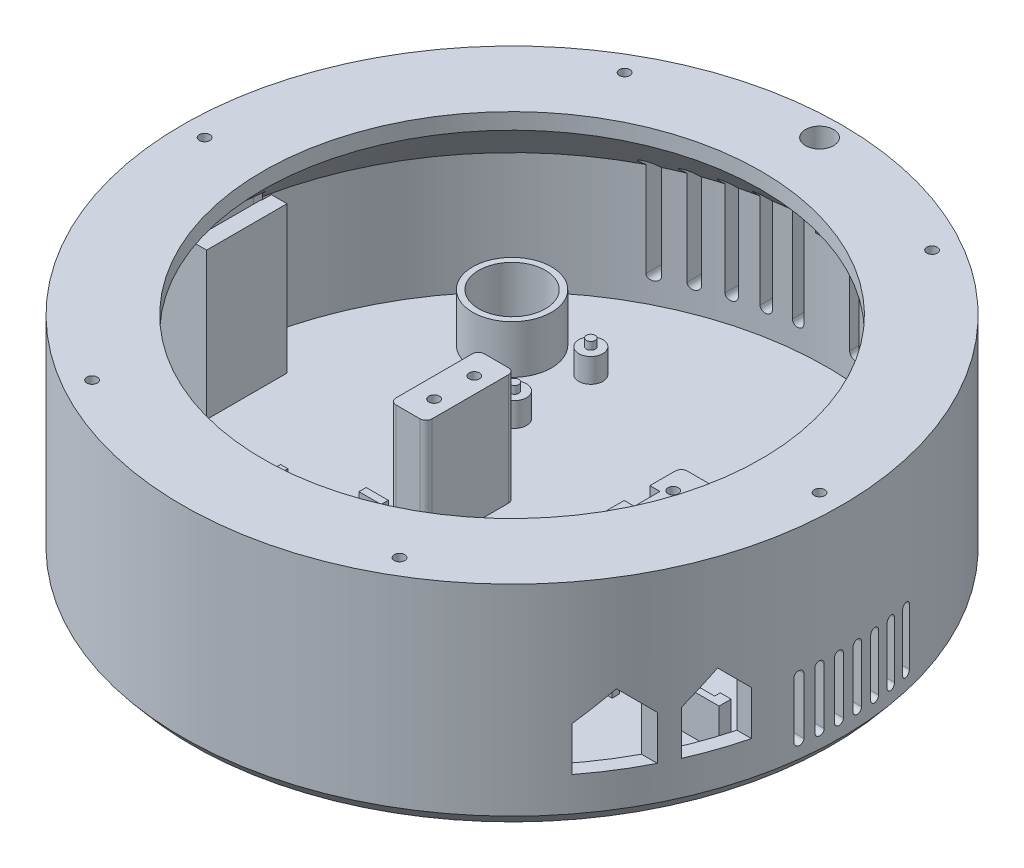
from build123d import *

# Parameters (mm, degrees)
PAN_START                                    = 2.3
PAN_SERVO_PILLARS_DEPTH                      = 27.9
PILLAR_START                                 = 17.2
SKETCH3_R                                    = 1.3
PILLAR_PILOT_HOLES_DEPTH                     = 13.2
SERVO_START                                  = 2.3
SKETCH4_W                                    = 10.2
SKETCH4_H                                    = 9
SERVO_LEAD_NOTCH_DEPTH                       = 10.7
PCA9685_START                                = 2.3
SKETCH5_R                                    = 3
PCA9685_POSTS_DEPTH                          = 6.2
PCA9685_START_2                              = 8.3
SKETCH6_R                                    = 1.1
PCA9685_LOCATING_PINS_DEPTH                  = 2.1
ESP32_START                                  = 2.3
SKETCH7_R                                    = 2.7
ESP32_POSTS_DEPTH                            = 10.2
SKETCH8_W                                    = 5.5
SKETCH8_H                                    = 1.8
ESP32_FENCES_DEPTH                           = 13.2
AMP_START                                    = 2.3
SKETCH9_R                                    = 2.7
AMP_POSTS_DEPTH                              = 7.7
SKETCH10_W                                   = 1.8
SKETCH10_H                                   = 5
AMP_FENCES_DEPTH                             = 10.7
SPEAKER_START                                = 2.3
SKETCH11_W                                   = 11.5
SKETCH11_H                                   = 3
SPEAKER_RAILS_DEPTH                          = 24.2
SPEAKER_START_2                              = 3.5
SKETCH12_W                                   = 6.1
SKETCH12_H                                   = 1.5
SPEAKER_GROOVES_DEPTH                        = 23.2
MIC_START                                    = 2.3
SKETCH13_W                                   = 13.5
SKETCH13_H                                   = 20
MIC_BLOCK_DEPTH                              = 36.7
MIC_START_2                                  = 22
SKETCH14_W                                   = 1.9
SKETCH14_H                                   = 15.6
MIC_SLOT_DEPTH                               = 17.2
MIC_START_3                                  = -90
SKETCH15_R                                   = 1.25
MIC_PORT_DEPTH                               = 19
CAP_START                                    = 2.3
SKETCH16_R                                   = 9.8
SKETCH16_R_2                                 = 8.3
CAP_CLIP_DEPTH                               = 12.2
SPEAKER_START_3                              = 66
SPEAKER_GRILLE_DEPTH                         = 24
USB_START                                    = 46
USB_WINDOWS_DEPTH                            = 44
BACK_START                                   = -90
BACK_VENTS_DEPTH                             = 30
RING_START                                   = 41
SKETCH20_R                                   = 1.3
RING_PILOT_HOLES_DEPTH                       = 12.2
MX_START                                     = 30
SKETCH21_R                                   = 3.5
MX_LEAD_HOLE_DEPTH                           = 23.2
HAND_START                                   = 12.5
SKETCH22_W                                   = 11.5
SKETCH22_H                                   = 3
HAND_FIX_SPEAKER_RAILS_SNIPPED_TO_10_M_DEPTH = 14.2
HAND_START_2                                 = 22
SKETCH23_W                                   = 2.2
SKETCH23_H                                   = 2.6
HAND_FIX_MIC_SLOT_END_WALL_NIBBLED_OUT_DEPTH = 17.2
HAND_START_3                                 = 12.8
SKETCH24_W                                   = 3
SKETCH24_H                                   = 6.4
HAND_FIX_GROOVE_FOR_THE_PAN_SERVO_S_CA_DEPTH = 17.6


with BuildPart() as part:
    # Sketch1 → Shell + slew ring (revolve)
    with BuildSketch(Plane.XY):
        Polygon((0, 0), (79.5, 0), (82, 3), (82, 53), (62, 53), (62, 49), (78.5, 32.5), (78.5, 2.5), (0, 2.5), align=None)
    revolve(axis=Axis((0, -5, 0), (0, 1, 0)))

    # Sketch2 → Pan servo pillars (add)
    with BuildSketch(Plane(origin=(0, 0, 0), x_dir=(1, 0, 0), z_dir=(0, 1, 0)).offset(PAN_START)):
        with BuildLine():
            Line((-17.9, 11), (-11.9, 11))
            ThreePointArc((-11.9, 11), (-10.839339828, 10.560660172), (-10.4, 9.5))
            Line((-10.4, 9.5), (-10.4, -9.5))
            ThreePointArc((-10.4, -9.5), (-10.839339828, -10.560660172), (-11.9, -11))
            Line((-11.9, -11), (-17.9, -11))
            ThreePointArc((-17.9, -11), (-18.960660172, -10.560660172), (-19.4, -9.5))
            Line((-19.4, -9.5), (-19.4, 9.5))
            ThreePointArc((-19.4, 9.5), (-18.960660172, 10.560660172), (-17.9, 11))
        make_face()
        with BuildLine():
            Line((32.6, 11), (38.6, 11))
            ThreePointArc((38.6, 11), (39.660660172, 10.560660172), (40.1, 9.5))
            Line((40.1, 9.5), (40.1, -9.5))
            ThreePointArc((40.1, -9.5), (39.660660172, -10.560660172), (38.6, -11))
            Line((38.6, -11), (32.6, -11))
            ThreePointArc((32.6, -11), (31.539339828, -10.560660172), (31.1, -9.5))
            Line((31.1, -9.5), (31.1, 9.5))
            ThreePointArc((31.1, 9.5), (31.539339828, 10.560660172), (32.6, 11))
        make_face()
    extrude(amount=PAN_SERVO_PILLARS_DEPTH)

    # Sketch3 → Pillar pilot holes (cut)
    with BuildSketch(Plane(origin=(0, 0, 0), x_dir=(1, 0, 0), z_dir=(0, 1, 0)).offset(PILLAR_START)):
        with Locations((-14.4, 5)):
            Circle(SKETCH3_R)
        with Locations((-14.4, -5)):
            Circle(SKETCH3_R)
        with Locations((35.1, 5)):
            Circle(SKETCH3_R)
        with Locations((35.1, -5)):
            Circle(SKETCH3_R)
    extrude(amount=PILLAR_PILOT_HOLES_DEPTH, mode=Mode.SUBTRACT)

    # Sketch4 → Servo lead notch (cut)
    with BuildSketch(Plane(origin=(0, 0, 0), x_dir=(1, 0, 0), z_dir=(0, 1, 0)).offset(SERVO_START)):
        with Locations((35.6, 0)):
            Rectangle(SKETCH4_W, SKETCH4_H)
    extrude(amount=SERVO_LEAD_NOTCH_DEPTH, mode=Mode.SUBTRACT)

    # Sketch5 → PCA9685 posts (add)
    with BuildSketch(Plane(origin=(0, 0, 0), x_dir=(1, 0, 0), z_dir=(0, 1, 0)).offset(PCA9685_START)):
        with Locations((-27.9, 47.5)):
            Circle(SKETCH5_R)
        with Locations((-27.9, 28.5)):
            Circle(SKETCH5_R)
        with Locations((27.9, 47.5)):
            Circle(SKETCH5_R)
        with Locations((27.9, 28.5)):
            Circle(SKETCH5_R)
    extrude(amount=PCA9685_POSTS_DEPTH)

    # Sketch6 → PCA9685 locating pins (add)
    with BuildSketch(Plane(origin=(0, 0, 0), x_dir=(1, 0, 0), z_dir=(0, 1, 0)).offset(PCA9685_START_2)):
        with Locations((-27.9, 47.5)):
            Circle(SKETCH6_R)
        with Locations((-27.9, 28.5)):
            Circle(SKETCH6_R)
        with Locations((27.9, 47.5)):
            Circle(SKETCH6_R)
        with Locations((27.9, 28.5)):
            Circle(SKETCH6_R)
    extrude(amount=PCA9685_LOCATING_PINS_DEPTH)

    # Sketch7 → ESP32 posts (add)
    with BuildSketch(Plane(origin=(0, 0, 0), x_dir=(1, 0, 0), z_dir=(0, 1, 0)).offset(ESP32_START)):
        with Locations((-16.5, -26.5)):
            Circle(SKETCH7_R)
        with Locations((-16.5, -43.5)):
            Circle(SKETCH7_R)
        with Locations((39.5, -26.5)):
            Circle(SKETCH7_R)
        with Locations((39.5, -43.5)):
            Circle(SKETCH7_R)
    extrude(amount=ESP32_POSTS_DEPTH)

    # Sketch8 → ESP32 fences (add)
    with BuildSketch(Plane(origin=(0, 0, 0), x_dir=(1, 0, 0), z_dir=(0, 1, 0)).offset(ESP32_START)):
        with Locations((-15.75, -18.7)):
            Rectangle(SKETCH8_W, SKETCH8_H)
        with Locations((-15.75, -51.3)):
            Rectangle(SKETCH8_W, SKETCH8_H)
        with Locations((41.75, -18.7)):
            Rectangle(SKETCH8_W, SKETCH8_H)
        with Locations((41.75, -51.3)):
            Rectangle(SKETCH8_W, SKETCH8_H)
    extrude(amount=ESP32_FENCES_DEPTH)

    # Sketch9 → Amp posts (add)
    with BuildSketch(Plane(origin=(0, 0, 0), x_dir=(1, 0, 0), z_dir=(0, 1, 0)).offset(AMP_START)):
        with Locations((-54.5, -27.5)):
            Circle(SKETCH9_R)
        with Locations((-54.5, -36)):
            Circle(SKETCH9_R)
        with Locations((-39.5, -27.5)):
            Circle(SKETCH9_R)
        with Locations((-39.5, -36)):
            Circle(SKETCH9_R)
    extrude(amount=AMP_POSTS_DEPTH)

    # Sketch10 → Amp fences (add)
    with BuildSketch(Plane(origin=(0, 0, 0), x_dir=(1, 0, 0), z_dir=(0, 1, 0)).offset(AMP_START)):
        with Locations((-58.3, -23.5)):
            Rectangle(SKETCH10_W, SKETCH10_H)
        with Locations((-58.3, -36.5)):
            Rectangle(SKETCH10_W, SKETCH10_H)
        with Locations((-35.7, -23.5)):
            Rectangle(SKETCH10_W, SKETCH10_H)
        with Locations((-35.7, -36.5)):
            Rectangle(SKETCH10_W, SKETCH10_H)
    extrude(amount=AMP_FENCES_DEPTH)

    # Sketch11 → Speaker rails (add)
    with BuildSketch(Plane(origin=(0, 0, 0), x_dir=(1, 0, 0), z_dir=(0, 1, 0)).offset(SPEAKER_START)):
        with Locations((63.75, -16.5)):
            Rectangle(SKETCH11_W, SKETCH11_H)
        with Locations((63.75, 24.5)):
            Rectangle(SKETCH11_W, SKETCH11_H)
    extrude(amount=SPEAKER_RAILS_DEPTH)

    # Sketch12 → Speaker grooves (cut)
    with BuildSketch(Plane(origin=(0, 0, 0), x_dir=(1, 0, 0), z_dir=(0, 1, 0)).offset(SPEAKER_START_2)):
        with Locations((63.75, -15.65)):
            Rectangle(SKETCH12_W, SKETCH12_H)
        with Locations((63.75, 23.65)):
            Rectangle(SKETCH12_W, SKETCH12_H)
    extrude(amount=SPEAKER_GROOVES_DEPTH, mode=Mode.SUBTRACT)

    # Sketch13 → Mic block (add)
    with BuildSketch(Plane(origin=(0, 0, 0), x_dir=(1, 0, 0), z_dir=(0, 1, 0)).offset(MIC_START)):
        with Locations((-72.75, 0)):
            Rectangle(SKETCH13_W, SKETCH13_H)
    extrude(amount=MIC_BLOCK_DEPTH)

    # Sketch14 → Mic slot (cut)
    with BuildSketch(Plane(origin=(0, 0, 0), x_dir=(1, 0, 0), z_dir=(0, 1, 0)).offset(MIC_START_2)):
        with Locations((-71, 0)):
            Rectangle(SKETCH14_W, SKETCH14_H)
    extrude(amount=MIC_SLOT_DEPTH, mode=Mode.SUBTRACT)

    # Sketch15 → Mic port (cut)
    with BuildSketch(Plane(origin=(0, 0, 0), x_dir=(0, 0, -1), z_dir=(1, 0, 0)).offset(MIC_START_3)):
        with Locations((0, 30)):
            Circle(SKETCH15_R)
    extrude(amount=MIC_PORT_DEPTH, mode=Mode.SUBTRACT)

    # Sketch16 → Cap clip (add)
    with BuildSketch(Plane(origin=(0, 0, 0), x_dir=(1, 0, 0), z_dir=(0, 1, 0)).offset(CAP_START)):
        with Locations((-44, 44)):
            Circle(SKETCH16_R)
        with Locations((-44, 44)):
            Circle(SKETCH16_R_2, mode=Mode.SUBTRACT)
    extrude(amount=CAP_CLIP_DEPTH)

    # Sketch17 → Speaker grille (cut)
    with BuildSketch(Plane(origin=(0, 0, 0), x_dir=(0, 0, -1), z_dir=(1, 0, 0)).offset(SPEAKER_START_3)):
        with BuildLine():
            Line((16.9, 7), (16.9, 21))
            ThreePointArc((16.9, 21), (18, 22.1), (19.1, 21))
            Line((19.1, 21), (19.1, 7))
            ThreePointArc((19.1, 7), (18, 5.9), (16.9, 7))
        make_face()
        with BuildLine():
            Line((12.233333333, 7), (12.233333333, 21))
            ThreePointArc((12.233333333, 21), (13.333333333, 22.1), (14.433333333, 21))
            Line((14.433333333, 21), (14.433333333, 7))
            ThreePointArc((14.433333333, 7), (13.333333333, 5.9), (12.233333333, 7))
        make_face()
        with BuildLine():
            Line((7.566666667, 7), (7.566666667, 21))
            ThreePointArc((7.566666667, 21), (8.666666667, 22.1), (9.766666667, 21))
            Line((9.766666667, 21), (9.766666667, 7))
            ThreePointArc((9.766666667, 7), (8.666666667, 5.9), (7.566666667, 7))
        make_face()
        with BuildLine():
            Line((2.9, 7), (2.9, 21))
            ThreePointArc((2.9, 21), (4, 22.1), (5.1, 21))
            Line((5.1, 21), (5.1, 7))
            ThreePointArc((5.1, 7), (4, 5.9), (2.9, 7))
        make_face()
        with BuildLine():
            Line((-1.766666667, 7), (-1.766666667, 21))
            ThreePointArc((-1.766666667, 21), (-0.666666667, 22.1), (0.433333333, 21))
            Line((0.433333333, 21), (0.433333333, 7))
            ThreePointArc((0.433333333, 7), (-0.666666667, 5.9), (-1.766666667, 7))
        make_face()
        with BuildLine():
            Line((-6.433333333, 7), (-6.433333333, 21))
            ThreePointArc((-6.433333333, 21), (-5.333333333, 22.1), (-4.233333333, 21))
            Line((-4.233333333, 21), (-4.233333333, 7))
            ThreePointArc((-4.233333333, 7), (-5.333333333, 5.9), (-6.433333333, 7))
        make_face()
        with BuildLine():
            Line((-11.1, 7), (-11.1, 21))
            ThreePointArc((-11.1, 21), (-10, 22.1), (-8.9, 21))
            Line((-8.9, 21), (-8.9, 7))
            ThreePointArc((-8.9, 7), (-10, 5.9), (-11.1, 7))
        make_face()
    extrude(amount=SPEAKER_GRILLE_DEPTH, mode=Mode.SUBTRACT)

    # Sketch18 → USB windows (cut)
    with BuildSketch(Plane(origin=(0, 0, 0), x_dir=(0, 0, -1), z_dir=(1, 0, 0)).offset(USB_START)):
        Polygon((-19.97, 11.5), (-19.97, 22.5), (-26.47, 29), (-32.97, 22.5), (-32.97, 11.5), align=None)
        Polygon((-37.03, 11.5), (-37.03, 22.5), (-43.53, 29), (-50.03, 22.5), (-50.03, 11.5), align=None)
    extrude(amount=USB_WINDOWS_DEPTH, mode=Mode.SUBTRACT)

    # Sketch19 → Back vents (cut)
    with BuildSketch(Plane.XY.offset(BACK_START)):
        with BuildLine():
            Line((-36.3, 9), (-36.3, 34))
            ThreePointArc((-36.3, 34), (-35, 35.3), (-33.7, 34))
            Line((-33.7, 34), (-33.7, 9))
            ThreePointArc((-33.7, 9), (-35, 7.7), (-36.3, 9))
        make_face()
        with BuildLine():
            Line((-29.3, 9), (-29.3, 34))
            ThreePointArc((-29.3, 34), (-28, 35.3), (-26.7, 34))
            Line((-26.7, 34), (-26.7, 9))
            ThreePointArc((-26.7, 9), (-28, 7.7), (-29.3, 9))
        make_face()
        with BuildLine():
            Line((-22.3, 9), (-22.3, 34))
            ThreePointArc((-22.3, 34), (-21, 35.3), (-19.7, 34))
            Line((-19.7, 34), (-19.7, 9))
            ThreePointArc((-19.7, 9), (-21, 7.7), (-22.3, 9))
        make_face()
        with BuildLine():
            Line((-15.3, 9), (-15.3, 34))
            ThreePointArc((-15.3, 34), (-14, 35.3), (-12.7, 34))
            Line((-12.7, 34), (-12.7, 9))
            ThreePointArc((-12.7, 9), (-14, 7.7), (-15.3, 9))
        make_face()
        with BuildLine():
            Line((-8.3, 9), (-8.3, 34))
            ThreePointArc((-8.3, 34), (-7, 35.3), (-5.7, 34))
            Line((-5.7, 34), (-5.7, 9))
            ThreePointArc((-5.7, 9), (-7, 7.7), (-8.3, 9))
        make_face()
        with BuildLine():
            Line((5.7, 9), (5.7, 34))
            ThreePointArc((5.7, 34), (7, 35.3), (8.3, 34))
            Line((8.3, 34), (8.3, 9))
            ThreePointArc((8.3, 9), (7, 7.7), (5.7, 9))
        make_face()
        with BuildLine():
            Line((12.7, 9), (12.7, 34))
            ThreePointArc((12.7, 34), (14, 35.3), (15.3, 34))
            Line((15.3, 34), (15.3, 9))
            ThreePointArc((15.3, 9), (14, 7.7), (12.7, 9))
        make_face()
        with BuildLine():
            Line((19.7, 9), (19.7, 34))
            ThreePointArc((19.7, 34), (21, 35.3), (22.3, 34))
            Line((22.3, 34), (22.3, 9))
            ThreePointArc((22.3, 9), (21, 7.7), (19.7, 9))
        make_face()
        with BuildLine():
            Line((26.7, 9), (26.7, 34))
            ThreePointArc((26.7, 34), (28, 35.3), (29.3, 34))
            Line((29.3, 34), (29.3, 9))
            ThreePointArc((29.3, 9), (28, 7.7), (26.7, 9))
        make_face()
        with BuildLine():
            Line((33.7, 9), (33.7, 34))
            ThreePointArc((33.7, 34), (35, 35.3), (36.3, 34))
            Line((36.3, 34), (36.3, 9))
            ThreePointArc((36.3, 9), (35, 7.7), (33.7, 9))
        make_face()
    extrude(amount=BACK_VENTS_DEPTH, mode=Mode.SUBTRACT)

    # Sketch20 → Ring pilot holes (cut)
    with BuildSketch(Plane(origin=(0, 0, 0), x_dir=(1, 0, 0), z_dir=(0, 1, 0)).offset(RING_START)):
        with Locations((76.5, 0)):
            Circle(SKETCH20_R)
        with Locations((38.25, -66.25094339)):
            Circle(SKETCH20_R)
        with Locations((-38.25, -66.25094339)):
            Circle(SKETCH20_R)
        with Locations((-76.5, 0)):
            Circle(SKETCH20_R)
        with Locations((-38.25, 66.25094339)):
            Circle(SKETCH20_R)
        with Locations((38.25, 66.25094339)):
            Circle(SKETCH20_R)
    extrude(amount=RING_PILOT_HOLES_DEPTH, mode=Mode.SUBTRACT)

    # Sketch21 → MX lead hole (cut)
    with BuildSketch(Plane(origin=(0, 0, 0), x_dir=(1, 0, 0), z_dir=(0, 1, 0)).offset(MX_START)):
        with Locations((0, 76.5)):
            Circle(SKETCH21_R)
    extrude(amount=MX_LEAD_HOLE_DEPTH, mode=Mode.SUBTRACT)

    # Sketch22 → HAND FIX - speaker rails snipped to 10 mm (cut)
    with BuildSketch(Plane(origin=(0, 0, 0), x_dir=(1, 0, 0), z_dir=(0, 1, 0)).offset(HAND_START)):
        with Locations((63.75, -16.5)):
            Rectangle(SKETCH22_W, SKETCH22_H)
        with Locations((63.75, 24.5)):
            Rectangle(SKETCH22_W, SKETCH22_H)
    extrude(amount=HAND_FIX_SPEAKER_RAILS_SNIPPED_TO_10_M_DEPTH, mode=Mode.SUBTRACT)

    # Sketch23 → HAND FIX - mic slot end wall nibbled out (cut)
    with BuildSketch(Plane(origin=(0, 0, 0), x_dir=(1, 0, 0), z_dir=(0, 1, 0)).offset(HAND_START_2)):
        with Locations((-71, 8.9)):
            Rectangle(SKETCH23_W, SKETCH23_H)
    extrude(amount=HAND_FIX_MIC_SLOT_END_WALL_NIBBLED_OUT_DEPTH, mode=Mode.SUBTRACT)

    # Sketch24 → HAND FIX - groove for the pan servo's cable boot (cut)
    with BuildSketch(Plane(origin=(0, 0, 0), x_dir=(1, 0, 0), z_dir=(0, 1, 0)).offset(HAND_START_3)):
        with Locations((32.1, 0)):
            Rectangle(SKETCH24_W, SKETCH24_H)
    extrude(amount=HAND_FIX_GROOVE_FOR_THE_PAN_SERVO_S_CA_DEPTH, mode=Mode.SUBTRACT)


solid = part.part
